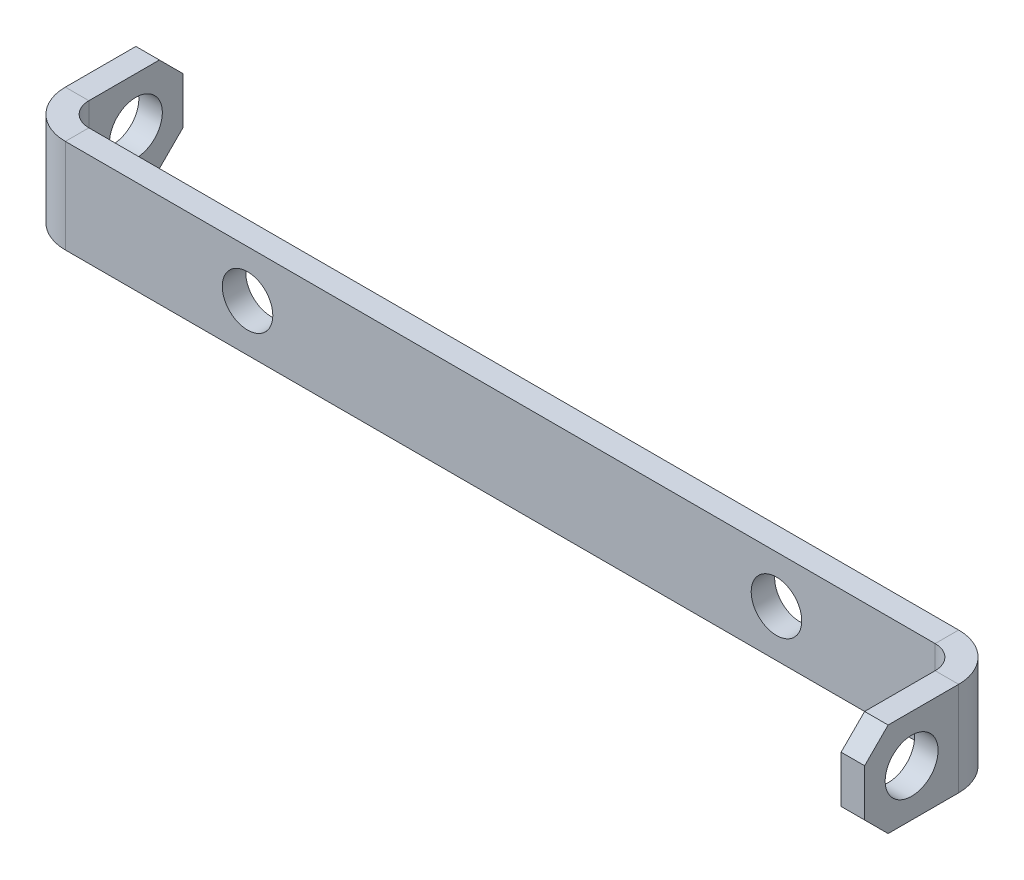
from build123d import *

# Parameters (mm, degrees)
SM_BASE_FLANGE_1_DEPTH = 8
SKETCH_6_R             = 2.15
CUT_EXTRUDE_1_DEPTH    = 45.407206622
CHAMFER_1_SIZE         = 2
SKETCH_7_R             = 2.25
CUT_EXTRUDE_2_DEPTH    = 84.258633186
SKETCH_8_R             = 2.25
CUT_EXTRUDE_3_DEPTH    = 84.258633186


# Sheet-metal steps are written as plain solids
with BuildPart() as part:
    # Sketch 1 → 基体-法兰1 (new body)
    with BuildSketch(Plane(origin=(0, 0, 0), x_dir=(1, 0, 0), z_dir=(0, 1, 0))):
        with BuildLine():
            Line((-40, 10), (-40, 2))
            ThreePointArc((-40, 2), (-39.414213562, 0.585786438), (-38, 0))
            Line((-38, 0), (36, 0))
            ThreePointArc((36, 0), (38.828427125, -1.171572875), (40, -4))
            Line((40, -4), (40, -12))
            Line((40, -12), (38, -12))
            Line((38, -12), (38, -4))
            ThreePointArc((38, -4), (37.414213562, -2.585786438), (36, -2))
            Line((36, -2), (-38, -2))
            ThreePointArc((-38, -2), (-40.828427125, -0.828427125), (-42, 2))
            Line((-42, 2), (-42, 10))
            Line((-42, 10), (-40, 10))
        make_face()
    extrude(amount=SM_BASE_FLANGE_1_DEPTH)

    # 草图6 → 切除-拉伸1 (cut, through all)
    with BuildSketch(Plane.XY.offset(2)):
        with Locations((-22.5, 4)):
            Circle(SKETCH_6_R)
        with Locations((22.5, 4)):
            Circle(SKETCH_6_R)
    extrude(amount=-CUT_EXTRUDE_1_DEPTH, mode=Mode.SUBTRACT)

    # 倒角1
    chamfer_1_edges = [part.edges().sort_by_distance(p)[0] for p in [
        (39, 0, 12),
        (-41, 0, -10),
        (39, 8, 12),
        (-41, 8, -10),
    ]]
    chamfer(chamfer_1_edges, length=CHAMFER_1_SIZE)

    # 草图7 → 切除-拉伸2 (cut, through all)
    with BuildSketch(Plane.ZY.offset(42)):
        with Locations((-6, 4)):
            Circle(SKETCH_7_R)
    extrude(amount=-CUT_EXTRUDE_2_DEPTH, mode=Mode.SUBTRACT)

    # 草图8 → 切除-拉伸3 (cut, through all)
    with BuildSketch(Plane(origin=(40, 0, 0), x_dir=(0, 0, -1), z_dir=(1, 0, 0))):
        with Locations((-8, 4)):
            Circle(SKETCH_8_R)
    extrude(amount=-CUT_EXTRUDE_3_DEPTH, mode=Mode.SUBTRACT)


solid = part.part
